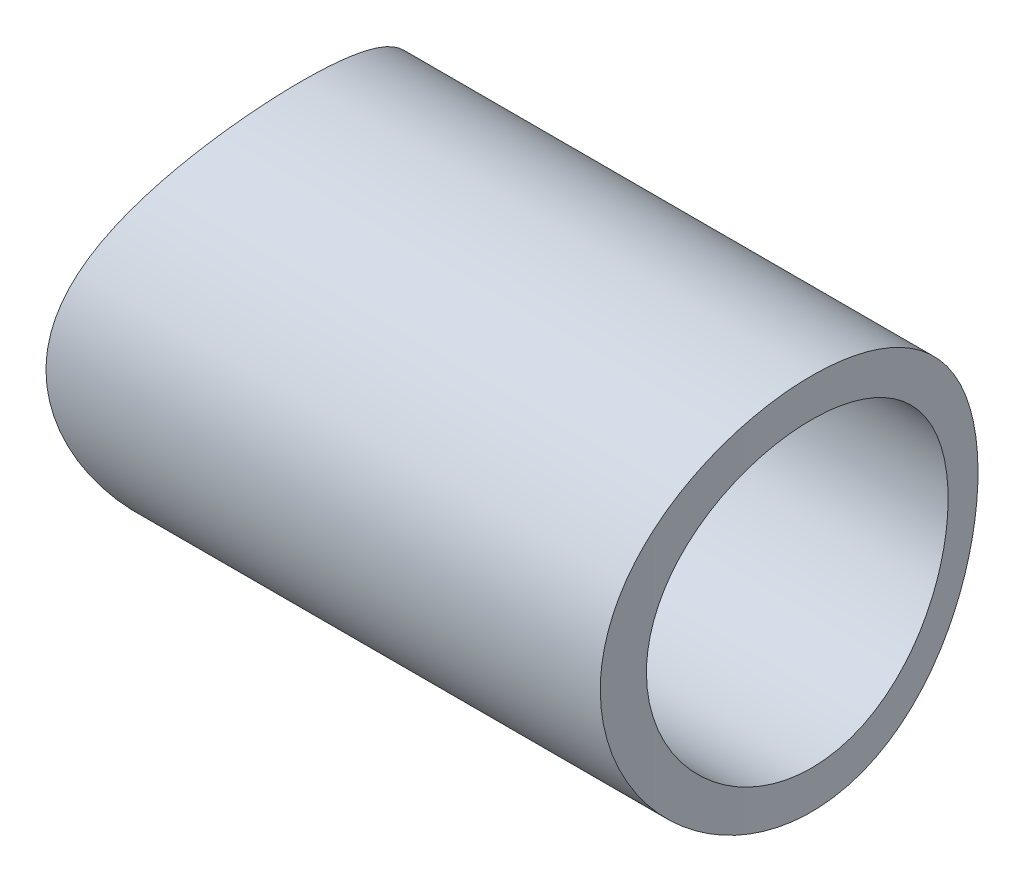
from build123d import *

# Parameters (mm, degrees)
SKETCH1_R                = 42.725
SKETCH1_R_2              = 15.875
BOSS_EXTRUDE1_DEPTH      = 1
SKETCH2_R                = 42.725
SKETCH2_R_2              = 41.725
SKETCH2_R_3              = 16.875
SKETCH2_R_4              = 15.875
BOSS_EXTRUDE2_DEPTH      = 25
SKETCH3_R                = 7.94
CUT_EXTRUDE1_DEPTH       = 66.778805477
BOSS_EXTRUDE3_REACH      = 67.779
BOSS_EXTRUDE3_END_RADIUS = 42.725
SKETCH9_R                = 9.94
SKETCH9_R_2              = 7.94
CUT_EXTRUDE2_DEPTH       = 66.778805647
CUT_EXTRUDE2_DEPTH_BACK  = 66.778805647
CUT_EXTRUDE4_DEPTH       = 53.449977529
CUT_EXTRUDE4_DEPTH_BACK  = 53.449977529
SKETCH11_R               = 50
SKETCH11_R_2             = 9.94


with BuildPart() as part:
    # Sketch1 → Boss-Extrude1 (new body)
    with BuildSketch(Plane(origin=(0, 0, 0), x_dir=(1, 0, 0), z_dir=(0, 1, 0))):
        Circle(SKETCH1_R)
        Circle(SKETCH1_R_2, mode=Mode.SUBTRACT)
    extrude(amount=BOSS_EXTRUDE1_DEPTH)

    # Sketch2 → Boss-Extrude2 (add)
    # profile 1 of 2: a face of its own
    with BuildSketch(Plane(origin=(0, 1, 0), x_dir=(1, 0, 0), z_dir=(0, 1, 0))):
        Circle(SKETCH2_R)
        Circle(SKETCH2_R_2, mode=Mode.SUBTRACT)
    # profile 2 of 2: a face of its own
    with BuildSketch(Plane(origin=(0, 1, 0), x_dir=(1, 0, 0), z_dir=(0, 1, 0))):
        Circle(SKETCH2_R_3)
        Circle(SKETCH2_R_4, mode=Mode.SUBTRACT)
    extrude(amount=BOSS_EXTRUDE2_DEPTH)

    # Sketch3 → Cut-Extrude1 (cut, through all)
    with BuildSketch(Plane(origin=(0, 0, 0), x_dir=(0, 0, -1), z_dir=(1, 0, 0))):
        with Locations((0, 11)):
            Circle(SKETCH3_R)
    extrude(amount=CUT_EXTRUDE1_DEPTH, mode=Mode.SUBTRACT)

    # Boss-Extrude3: up to this cylinder (the profile starts inside it)
    boss_extrude3_end = Plane(origin=(0, 11, 0), z_dir=(0, -1, 0)) * Cylinder(BOSS_EXTRUDE3_END_RADIUS, 222.008, mode=Mode.PRIVATE)
    # Sketch9 → Boss-Extrude3 (add, up to the surface)
    with BuildSketch(Plane(origin=(0, 0, 0), x_dir=(0, 0, -1), z_dir=(1, 0, 0)), mode=Mode.PRIVATE) as boss_extrude3_sk1:
        with Locations((0, 11)):
            Circle(SKETCH9_R)
        with Locations((0, 11)):
            Circle(SKETCH9_R_2, mode=Mode.SUBTRACT)
    boss_extrude3_tool1 = extrude(boss_extrude3_sk1.sketch, amount=BOSS_EXTRUDE3_REACH, mode=Mode.PRIVATE) & boss_extrude3_end
    add(boss_extrude3_tool1.solids().sort_by_distance((0, 11, 9.658854))[0])

    # Sketch10 → Cut-Extrude2 (cut, two sides: drawn at the far end of the back side and taken through both)
    with BuildSketch(Plane(origin=(0, 26, 0), x_dir=(1, 0, 0), z_dir=(0, 1, 0)).offset(-CUT_EXTRUDE2_DEPTH_BACK)):
        with BuildLine():
            ThreePointArc((1.562409729, -15.797927106), (15.875, 0), (1.562409729, 15.797927106))
            Line((1.562409729, 15.797927106), (41.036063238, 11.893995921))
            ThreePointArc((41.036063238, 11.893995921), (-42.725, 0), (41.036063238, -11.893995921))
            Line((41.036063238, -11.893995921), (1.562409729, -15.797927106))
        make_face()
    extrude(amount=CUT_EXTRUDE2_DEPTH + CUT_EXTRUDE2_DEPTH_BACK, mode=Mode.SUBTRACT)

    # Sketch11 → Cut-Extrude4 (cut, two sides: drawn at the far end of the back side and taken through both)
    with BuildSketch(Plane(origin=(0, 0, 0), x_dir=(0, 0, -1), z_dir=(1, 0, 0)).offset(-CUT_EXTRUDE4_DEPTH_BACK)):
        with Locations((0, 11)):
            Circle(SKETCH11_R)
        with Locations((0, 11)):
            Circle(SKETCH11_R_2, mode=Mode.SUBTRACT)
    extrude(amount=CUT_EXTRUDE4_DEPTH + CUT_EXTRUDE4_DEPTH_BACK, mode=Mode.SUBTRACT)


solid = part.part
